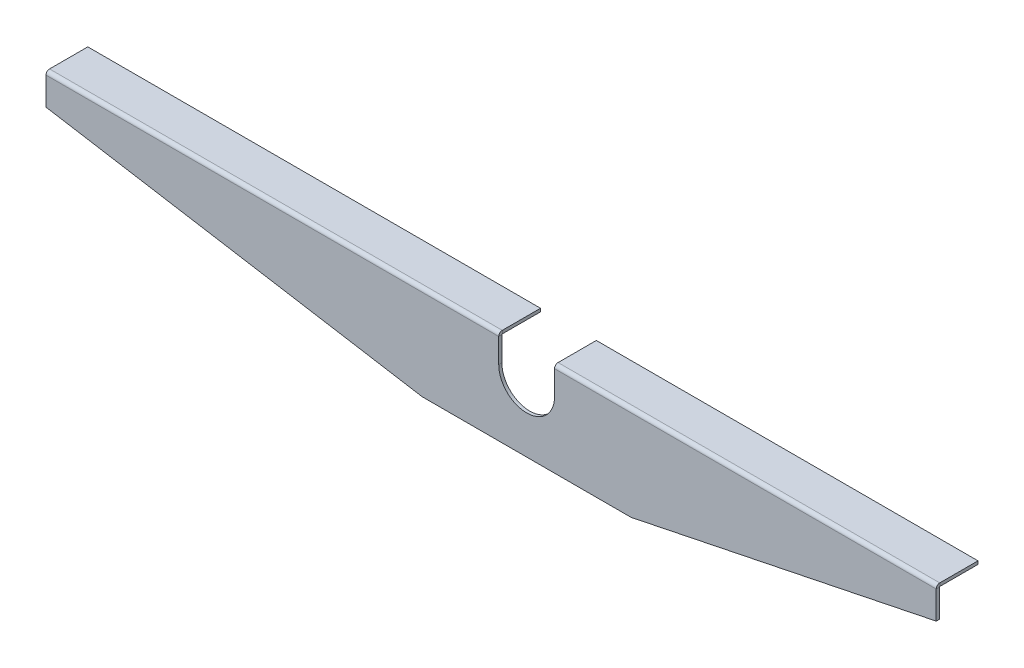
from build123d import *

# Parameters (mm, degrees)
BASE_FLANGE1_DEPTH             = 1.5
EDGE_FLANGE1_STRIP_W           = 6.4
EDGE_FLANGE1_STRIP_H           = 1.5
EDGE_FLANGE1_STRIP_CUT_DEPTH   = 216.65
EDGE_FLANGE1_STRIP_2_W         = 6.4
EDGE_FLANGE1_STRIP_2_H         = 1.5
EDGE_FLANGE1_STRIP_CUT_2_DEPTH = 182.65
EDGE_FLANGE1_DEPTH             = 216.65
EDGE_FLANGE1_BEND_DEPTH        = 182.65


# Sheet-metal steps are written as plain solids
with BuildPart() as part:
    # Sketch1 → Base-Flange1 (new body)
    with BuildSketch(Plane.XY):
        with BuildLine():
            Line((13.35, 0), (13.35, 13.35))
            Line((13.35, 13.35), (196, 13.35))
            Line((196, 13.35), (196, -1.65))
            Line((196, -1.65), (50, -31.65))
            Line((50, -31.65), (-50, -31.65))
            Line((-50, -31.65), (-230, -1.65))
            Line((-230, -1.65), (-230, 13.35))
            Line((-230, 13.35), (-13.35, 13.35))
            Line((-13.35, 13.35), (-13.35, 0))
            ThreePointArc((-13.35, 0), (0, -13.35), (13.35, 0))
        make_face()
    extrude(amount=-BASE_FLANGE1_DEPTH)

    # Edge-Flange1 strip (across the edge) → Edge-Flange1 strip cut (cut)
    with BuildSketch(Plane(origin=(-230, 13.35, -1.5), x_dir=(0, -1, 0), z_dir=(1, 0, 0))):
        with Locations((-1.5, -0.75)):
            Rectangle(EDGE_FLANGE1_STRIP_W, EDGE_FLANGE1_STRIP_H)
    extrude(amount=EDGE_FLANGE1_STRIP_CUT_DEPTH, mode=Mode.SUBTRACT)

    # Edge-Flange1 strip 2 (across the edge) → Edge-Flange1 strip cut 2 (cut)
    with BuildSketch(Plane(origin=(13.35, 13.35, -1.5), x_dir=(0, -1, 0), z_dir=(1, 0, 0))):
        with Locations((-1.5, -0.75)):
            Rectangle(EDGE_FLANGE1_STRIP_2_W, EDGE_FLANGE1_STRIP_2_H)
    extrude(amount=EDGE_FLANGE1_STRIP_CUT_2_DEPTH, mode=Mode.SUBTRACT)

    # Edge-Flange1 section (across the edge) → Edge-Flange1 (add)
    with BuildSketch(Plane(origin=(-230, 13.35, -1.5), x_dir=(0, -1, 0), z_dir=(1, 0, 0))):
        with BuildLine():
            Line((0, 0.2), (0, 18.5))
            Line((0, 18.5), (1.5, 18.5))
            Line((1.5, 18.5), (1.5, 0.2))
            ThreePointArc((1.5, 0.2), (1.558578644, 0.058578644), (1.7, 0))
            Line((1.7, 0), (1.7, -1.5))
            ThreePointArc((1.7, -1.5), (0.497918472, -1.002081528), (0, 0.2))
        make_face()
    extrude(amount=EDGE_FLANGE1_DEPTH)

    # Edge-Flange1 section 2 (across the edge) → Edge-Flange1 bend (add)
    with BuildSketch(Plane(origin=(13.35, 13.35, -1.5), x_dir=(0, -1, 0), z_dir=(1, 0, 0))):
        with BuildLine():
            Line((0, 0.2), (0, 18.5))
            Line((0, 18.5), (1.5, 18.5))
            Line((1.5, 18.5), (1.5, 0.2))
            ThreePointArc((1.5, 0.2), (1.558578644, 0.058578644), (1.7, 0))
            Line((1.7, 0), (1.7, -1.5))
            ThreePointArc((1.7, -1.5), (0.497918472, -1.002081528), (0, 0.2))
        make_face()
    extrude(amount=EDGE_FLANGE1_BEND_DEPTH)


solid = part.part
